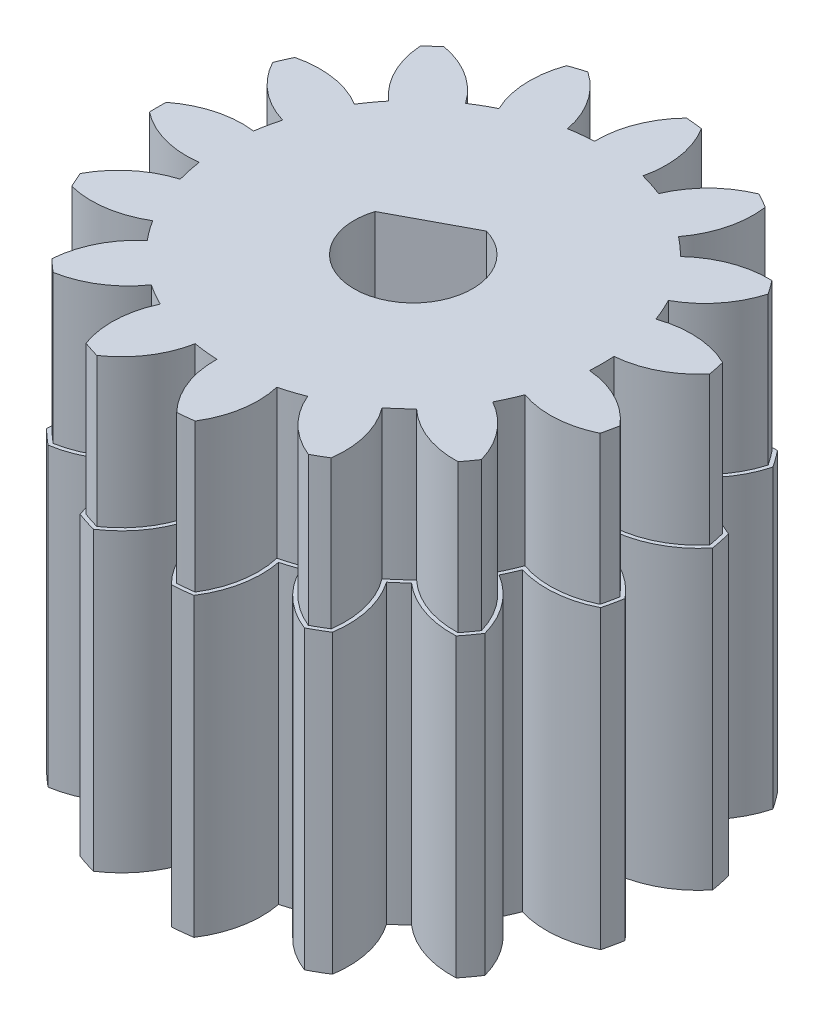
from build123d import *

# Parameters (mm, degrees)
SKETCH1_R           = 56.531668112
BOSS_EXTRUDE1_DEPTH = 5
SKETCH2_R           = 93.360470672
CUT_EXTRUDE1_DEPTH  = 83.481553238
CUT_EXTRUDE2_DEPTH  = 14.170680132
BOSS_EXTRUDE2_DEPTH = 10


with BuildPart() as part:
    # Sketch1 → Boss-Extrude1 (new body)
    with BuildSketch(Plane(origin=(0, 0, 0), x_dir=(1, 0, 0), z_dir=(0, 1, 0))):
        Circle(SKETCH1_R)
    extrude(amount=BOSS_EXTRUDE1_DEPTH)

    # Sketch2 → Cut-Extrude1 (cut, through all)
    with BuildSketch(Plane(origin=(0.053951493, 9.696123263, -2.690451675), x_dir=(0, 0, 1), z_dir=(0, 1, 0))):
        with Locations((2.690451675, -0.053951493)):
            Circle(SKETCH2_R)
        with BuildLine():
            ThreePointArc((7.987976033, 6.754966533), (7.789005891, 5.548363877), (7.142485611, 4.510341424))
            ThreePointArc((7.142485611, 4.510341424), (7.428743082, 4.212425253), (7.695105184, 3.89659521))
            ThreePointArc((7.695105184, 3.89659521), (8.795021012, 4.431070894), (10.015811815, 4.502826734))
            ThreePointArc((10.015811815, 4.502826734), (10.161652833, 4.259548507), (10.299417449, 4.011607367))
            ThreePointArc((10.299417449, 4.011607367), (9.626879667, 2.990249439), (8.614052233, 2.304932231))
            ThreePointArc((8.614052233, 2.304932231), (8.754388023, 1.916340863), (8.869262259, 1.519476535))
            ThreePointArc((8.869262259, 1.519476535), (10.091476214, 1.560368296), (11.235909836, 1.129380165))
            ThreePointArc((11.235909836, 1.129380165), (11.270192066, 0.84781556), (11.295199558, 0.56527614))
            ThreePointArc((11.295199558, 0.56527614), (10.265382027, -0.094234996), (9.061374505, -0.308349388))
            ThreePointArc((9.061374505, -0.308349388), (9.03152328, -0.720424975), (8.975046852, -1.12970214))
            ThreePointArc((8.975046852, -1.12970214), (10.108227036, -1.589464859), (10.978420508, -2.448675198))
            ThreePointArc((10.978420508, -2.448675198), (10.895216241, -2.719841104), (10.803142587, -2.98812517))
            ThreePointArc((10.803142587, -2.98812517), (9.594110113, -3.171754047), (8.407106342, -2.8776433))
            ThreePointArc((8.407106342, -2.8776433), (8.212229649, -3.241951493), (7.994167845, -3.592873756))
            ThreePointArc((7.994167845, -3.592873756), (8.84237711, -4.473793803), (9.287866075, -5.612661077))
            ThreePointArc((9.287866075, -5.612661077), (9.101562084, -5.826541234), (8.908327655, -6.034181196))
            ThreePointArc((8.908327655, -6.034181196), (7.729132938, -5.710176712), (6.764376652, -4.958695246))
            ThreePointArc((6.764376652, -4.958695246), (6.438170443, -5.212243849), (6.09622813, -5.444133562))
            ThreePointArc((6.09622813, -5.444133562), (6.512803388, -6.593891859), (6.456558756, -7.81549557))
            ThreePointArc((6.456558756, -7.81549557), (6.199368695, -7.935108156), (5.938385479, -8.046201177))
            ThreePointArc((5.938385479, -8.046201177), (4.992921997, -7.270586652), (4.417228324, -6.191672439))
            ThreePointArc((4.417228324, -6.191672439), (4.016096616, -6.290620595), (3.609398725, -6.363381921))
            ThreePointArc((3.609398725, -6.363381921), (3.52231033, -7.583174812), (2.974057309, -8.67628858))
            ThreePointArc((2.974057309, -8.67628858), (2.690451675, -8.680951493), (2.406846041, -8.67628858))
            ThreePointArc((2.406846041, -8.67628858), (1.85859302, -7.583174812), (1.771504625, -6.363381921))
            ThreePointArc((1.771504625, -6.363381921), (1.364806734, -6.290620595), (0.963675026, -6.191672439))
            ThreePointArc((0.963675026, -6.191672439), (0.387981353, -7.270586652), (-0.557482129, -8.046201177))
            ThreePointArc((-0.557482129, -8.046201177), (-0.818465345, -7.935108156), (-1.075655406, -7.81549557))
            ThreePointArc((-1.075655406, -7.81549557), (-1.131900038, -6.593891859), (-0.71532478, -5.444133562))
            ThreePointArc((-0.71532478, -5.444133562), (-1.057267094, -5.212243849), (-1.383473303, -4.958695246))
            ThreePointArc((-1.383473303, -4.958695246), (-2.348229588, -5.710176712), (-3.527424305, -6.034181196))
            ThreePointArc((-3.527424305, -6.034181196), (-3.720658735, -5.826541234), (-3.906962725, -5.612661077))
            ThreePointArc((-3.906962725, -5.612661077), (-3.46147376, -4.473793803), (-2.613264496, -3.592873756))
            ThreePointArc((-2.613264496, -3.592873756), (-2.8313263, -3.241951493), (-3.026202992, -2.8776433))
            ThreePointArc((-3.026202992, -2.8776433), (-4.213206764, -3.171754047), (-5.422239237, -2.98812517))
            ThreePointArc((-5.422239237, -2.98812517), (-5.514312891, -2.719841104), (-5.597517158, -2.448675198))
            ThreePointArc((-5.597517158, -2.448675198), (-4.727323686, -1.589464859), (-3.594143503, -1.12970214))
            ThreePointArc((-3.594143503, -1.12970214), (-3.65061993, -0.720424975), (-3.680471156, -0.308349388))
            ThreePointArc((-3.680471156, -0.308349388), (-4.884478677, -0.094234996), (-5.914296209, 0.56527614))
            ThreePointArc((-5.914296209, 0.56527614), (-5.889288716, 0.84781556), (-5.855006486, 1.129380165))
            ThreePointArc((-5.855006486, 1.129380165), (-4.710572864, 1.560368296), (-3.48835891, 1.519476535))
            ThreePointArc((-3.48835891, 1.519476535), (-3.373484673, 1.916340863), (-3.233148884, 2.304932231))
            ThreePointArc((-3.233148884, 2.304932231), (-4.245976317, 2.990249439), (-4.9185141, 4.011607367))
            ThreePointArc((-4.9185141, 4.011607367), (-4.780749484, 4.259548507), (-4.634908466, 4.502826734))
            ThreePointArc((-4.634908466, 4.502826734), (-3.414117662, 4.431070894), (-2.314201834, 3.89659521))
            ThreePointArc((-2.314201834, 3.89659521), (-2.047839732, 4.212425253), (-1.761582261, 4.510341424))
            ThreePointArc((-1.761582261, 4.510341424), (-2.408102542, 5.548363877), (-2.607072683, 6.754966533))
            ThreePointArc((-2.607072683, 6.754966533), (-2.380371697, 6.925438117), (-2.148189128, 7.088364951))
            ThreePointArc((-2.148189128, 7.088364951), (-1.062126964, 6.526272375), (-0.274694701, 5.590628471))
            ThreePointArc((-0.274694701, 5.590628471), (0.097098839, 5.770814345), (0.479781475, 5.926542907))
            ThreePointArc((0.479781475, 5.926542907), (0.311357577, 7.137787092), (0.620358822, 8.321001915))
            ThreePointArc((0.620358822, 8.321001915), (0.896797518, 8.384527858), (1.175175163, 8.438931768))
            ThreePointArc((1.175175163, 8.438931768), (1.938718671, 7.483693371), (2.277513178, 6.308662576))
            ThreePointArc((2.277513178, 6.308662576), (2.690451675, 6.322048507), (3.103390171, 6.308662576))
            ThreePointArc((3.103390171, 6.308662576), (3.442184678, 7.483693371), (4.205728187, 8.438931768))
            ThreePointArc((4.205728187, 8.438931768), (4.484105832, 8.384527858), (4.760544528, 8.321001915))
            ThreePointArc((4.760544528, 8.321001915), (5.069545773, 7.137787092), (4.901121875, 5.926542907))
            ThreePointArc((4.901121875, 5.926542907), (5.283804511, 5.770814345), (5.65559805, 5.590628471))
            ThreePointArc((5.65559805, 5.590628471), (6.443030314, 6.526272375), (7.529092477, 7.088364951))
            ThreePointArc((7.529092477, 7.088364951), (7.761275046, 6.925438117), (7.987976033, 6.754966533))
        make_face(mode=Mode.SUBTRACT)
    extrude(amount=-CUT_EXTRUDE1_DEPTH, mode=Mode.SUBTRACT)

    # Sketch3 → Cut-Extrude2 (cut, through all)
    with BuildSketch(Plane(origin=(0, 5, 0), x_dir=(1, 0, 0), z_dir=(0, 1, 0))):
        with BuildLine():
            Line((-1.902202661, 0.617758073), (0.547338577, 1.923647702))
            ThreePointArc((0.547338577, 1.923647702), (0.940877836, -1.764865122), (-1.902202661, 0.617758073))
        make_face()
    extrude(amount=-CUT_EXTRUDE2_DEPTH, mode=Mode.SUBTRACT)

    # Sketch4 → Boss-Extrude2 (add)
    with BuildSketch(Plane.XZ):
        with BuildLine():
            ThreePointArc((7.280358548, -4.860956224), (6.735610293, -3.74562718), (5.812857079, -2.915424769))
            ThreePointArc((5.812857079, -2.915424769), (5.940786111, -2.64500839), (6.056143413, -2.368994716))
            ThreePointArc((6.056143413, -2.368994716), (7.290546456, -2.499220149), (8.483905194, -2.157746197))
            ThreePointArc((8.483905194, -2.157746197), (8.562704097, -1.820058941), (8.628067498, -1.479515882))
            ThreePointArc((8.628067498, -1.479515882), (7.676770013, -0.682181177), (6.496119264, -0.29907108))
            ThreePointArc((6.496119264, -0.29907108), (6.503, 0), (6.496119264, 0.29907108))
            ThreePointArc((6.496119264, 0.29907108), (7.676770013, 0.682181177), (8.628067498, 1.479515882))
            ThreePointArc((8.628067498, 1.479515882), (8.562704097, 1.820058941), (8.483905194, 2.157746197))
            ThreePointArc((8.483905194, 2.157746197), (7.290546456, 2.499220149), (6.056143413, 2.368994716))
            ThreePointArc((6.056143413, 2.368994716), (5.940786111, 2.64500839), (5.812857079, 2.915424769))
            ThreePointArc((5.812857079, 2.915424769), (6.735610293, 3.74562718), (7.280358548, 4.860956224))
            ThreePointArc((7.280358548, 4.860956224), (7.082134769, 5.145472099), (6.872798609, 5.421914356))
            ThreePointArc((6.872798609, 5.421914356), (5.643721185, 5.248483607), (4.569005347, 4.627439804))
            ThreePointArc((4.569005347, 4.627439804), (4.351356333, 4.8326708), (4.124499097, 5.027675029))
            ThreePointArc((4.124499097, 5.027675029), (4.629802362, 6.161420216), (4.673809465, 7.401893074))
            ThreePointArc((4.673809465, 7.401893074), (4.377, 7.581186385), (4.073322706, 7.748584266))
            ThreePointArc((4.073322706, 7.748584266), (3.021045249, 7.090236568), (2.291844749, 6.08575851))
            ThreePointArc((2.291844749, 6.08575851), (2.009537514, 6.184720525), (1.722977751, 6.270594603))
            ThreePointArc((1.722977751, 6.270594603), (1.723459542, 7.511847722), (1.259116265, 8.662975368))
            ThreePointArc((1.259116265, 8.662975368), (0.915042167, 8.706044672), (0.569532302, 8.735453563))
            ThreePointArc((0.569532302, 8.735453563), (-0.123996855, 7.706023214), (-0.381596627, 6.491794283))
            ThreePointArc((-0.381596627, 6.491794283), (-0.679748597, 6.467375886), (-0.976462101, 6.429271402))
            ThreePointArc((-0.976462101, 6.429271402), (-1.480885089, 7.563408513), (-2.373289576, 8.42615052))
            ThreePointArc((-2.373289576, 8.42615052), (-2.705134769, 8.325548744), (-3.03273541, 8.21188358))
            ThreePointArc((-3.03273541, 8.21188358), (-3.247598777, 6.989368439), (-2.989056479, 5.775339848))
            ThreePointArc((-2.989056479, 5.775339848), (-3.2515, 5.631763201), (-3.507062784, 5.476268769))
            ThreePointArc((-3.507062784, 5.476268769), (-4.429171235, 6.307187262), (-5.595332088, 6.732367698))
            ThreePointArc((-5.595332088, 6.732367698), (-5.857569328, 6.505489802), (-6.110615619, 6.268404323))
            ThreePointArc((-6.110615619, 6.268404323), (-5.809661367, 5.064188364), (-5.079681312, 4.060276686))
            ThreePointArc((-5.079681312, 4.060276686), (-5.261037514, 3.822367496), (-5.431260452, 3.576369514))
            ThreePointArc((-5.431260452, 3.576369514), (-6.611613437, 3.960396034), (-7.849890851, 3.874497339))
            ThreePointArc((-7.849890851, 3.874497339), (-7.997176936, 3.560572573), (-8.131914874, 3.241061012))
            ThreePointArc((-8.131914874, 3.241061012), (-7.367180728, 2.263364115), (-6.291983098, 1.643154799))
            ThreePointArc((-6.291983098, 1.643154799), (-6.360893848, 1.352049725), (-6.416343846, 1.058083481))
            ThreePointArc((-6.416343846, 1.058083481), (-7.650847611, 0.928816352), (-8.747132171, 0.346691192))
            ThreePointArc((-8.747132171, 0.346691192), (-8.754, 0), (-8.747132171, -0.346691192))
            ThreePointArc((-8.747132171, -0.346691192), (-7.650847611, -0.928816352), (-6.416343846, -1.058083481))
            ThreePointArc((-6.416343846, -1.058083481), (-6.360893848, -1.352049725), (-6.291983098, -1.643154799))
            ThreePointArc((-6.291983098, -1.643154799), (-7.367180728, -2.263364115), (-8.131914874, -3.241061012))
            ThreePointArc((-8.131914874, -3.241061012), (-7.997176936, -3.560572573), (-7.849890851, -3.874497339))
            ThreePointArc((-7.849890851, -3.874497339), (-6.611613437, -3.960396034), (-5.431260452, -3.576369514))
            ThreePointArc((-5.431260452, -3.576369514), (-5.261037514, -3.822367496), (-5.079681312, -4.060276686))
            ThreePointArc((-5.079681312, -4.060276686), (-5.809661367, -5.064188364), (-6.110615619, -6.268404323))
            ThreePointArc((-6.110615619, -6.268404323), (-5.857569328, -6.505489802), (-5.595332088, -6.732367698))
            ThreePointArc((-5.595332088, -6.732367698), (-4.429171235, -6.307187262), (-3.507062784, -5.476268769))
            ThreePointArc((-3.507062784, -5.476268769), (-3.2515, -5.631763201), (-2.989056479, -5.775339848))
            ThreePointArc((-2.989056479, -5.775339848), (-3.247598777, -6.989368439), (-3.03273541, -8.21188358))
            ThreePointArc((-3.03273541, -8.21188358), (-2.705134769, -8.325548744), (-2.373289576, -8.42615052))
            ThreePointArc((-2.373289576, -8.42615052), (-1.480885089, -7.563408513), (-0.976462101, -6.429271402))
            ThreePointArc((-0.976462101, -6.429271402), (-0.679748597, -6.467375886), (-0.381596627, -6.491794283))
            ThreePointArc((-0.381596627, -6.491794283), (-0.123996855, -7.706023214), (0.569532302, -8.735453563))
            ThreePointArc((0.569532302, -8.735453563), (0.915042167, -8.706044672), (1.259116265, -8.662975368))
            ThreePointArc((1.259116265, -8.662975368), (1.723459542, -7.511847722), (1.722977751, -6.270594603))
            ThreePointArc((1.722977751, -6.270594603), (2.009537514, -6.184720525), (2.291844749, -6.08575851))
            ThreePointArc((2.291844749, -6.08575851), (3.021045249, -7.090236568), (4.073322706, -7.748584266))
            ThreePointArc((4.073322706, -7.748584266), (4.377, -7.581186385), (4.673809465, -7.401893074))
            ThreePointArc((4.673809465, -7.401893074), (4.629802362, -6.161420216), (4.124499097, -5.027675029))
            ThreePointArc((4.124499097, -5.027675029), (4.351356333, -4.8326708), (4.569005347, -4.627439804))
            ThreePointArc((4.569005347, -4.627439804), (5.643721185, -5.248483607), (6.872798609, -5.421914356))
            ThreePointArc((6.872798609, -5.421914356), (7.082134769, -5.145472099), (7.280358548, -4.860956224))
        make_face()
        with BuildLine():
            ThreePointArc((-1.819021862, -0.54877998), (0.893833944, 1.676621865), (0.558245561, -1.816139283))
            Line((0.558245561, -1.816139283), (-1.819021862, -0.54877998))
        make_face(mode=Mode.SUBTRACT)
    extrude(amount=BOSS_EXTRUDE2_DEPTH)


solid = part.part
